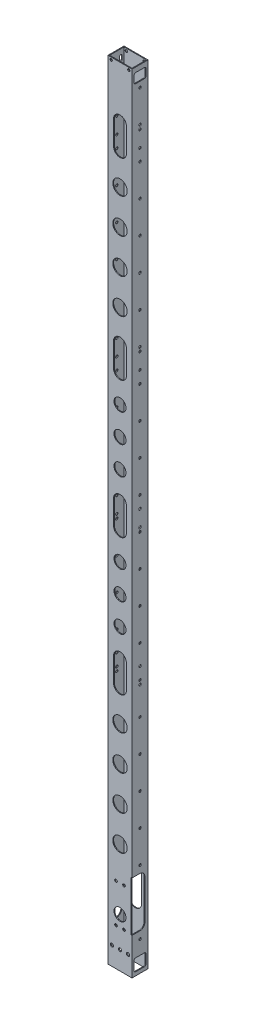
from build123d import *

# Parameters (mm, degrees)
SKETCH_1_W           = 30
SKETCH_1_H           = 20
SKETCH_1_W_2         = 28
SKETCH_1_H_2         = 18
EXTRUDE_1_DEPTH      = 980
SKETCH_3_R           = 1.5
CUT_EXTRUDE_2_DEPTH  = 981.51007134
CUT_EXTRUDE_3_DEPTH  = 981.51007134
SKETCH_5_W           = 15
SKETCH_5_H           = 12
CUT_EXTRUDE_4_DEPTH  = 10
SKETCH_6_R           = 9
SKETCH_6_R_2         = 7.5
CUT_EXTRUDE_5_DEPTH  = 981.318825689
SKETCH_9_R           = 1.5
CUT_EXTRUDE_7_DEPTH  = 981.318825689
SKETCH_13_W          = 30
SKETCH_13_H          = 20
SKETCH_13_W_2        = 28
SKETCH_13_H_2        = 18
EXTRUDE_2_DEPTH      = 10
CUT_EXTRUDE_8_DEPTH  = 60
SKETCH_15_W          = 15
SKETCH_15_H          = 15
CUT_EXTRUDE_10_DEPTH = 5
FILLET_1_R           = 2
SKETCH_16_R          = 2
CUT_EXTRUDE_11_DEPTH = 90
FILLET_2_R           = 2
SKETCH_17_R          = 1.5
CUT_EXTRUDE_12_DEPTH = 40
CUT_EXTRUDE_15_DEPTH = 51
SKETCH_21_W          = 22.187259215
SKETCH_21_H          = 65.33837704
EXTRUDE_3_DEPTH      = 1
SKETCH_22_R          = 1.65
CUT_EXTRUDE_16_DEPTH = 1
SKETCH_23_R          = 7.5
CUT_EXTRUDE_17_DEPTH = 10
SKETCH_24_W          = 30
SKETCH_24_H          = 20
CUT_EXTRUDE_18_DEPTH = 8
SKETCH_25_W          = 36.272891169
SKETCH_25_H          = 62
CUT_EXTRUDE_19_DEPTH = 1


with BuildPart() as part:
    # 草图1 → 凸台-拉伸1 (new body)
    with BuildSketch(Plane(origin=(0, 0, 0), x_dir=(1, 0, 0), z_dir=(0, 1, 0))):
        Rectangle(SKETCH_1_W, SKETCH_1_H)
        Rectangle(SKETCH_1_W_2, SKETCH_1_H_2, mode=Mode.SUBTRACT)
    extrude(amount=EXTRUDE_1_DEPTH)

    # 草图3 → 切除-拉伸2 (cut, through all)
    with BuildSketch(Plane(origin=(15, 0, 0), x_dir=(0, 0, -1), z_dir=(1, 0, 0))):
        with Locations((0, 890)):
            Circle(SKETCH_3_R)
        with Locations((0, 910)):
            Circle(SKETCH_3_R)
        with Locations((0, 500)):
            Circle(SKETCH_3_R)
        with Locations((0, 480)):
            Circle(SKETCH_3_R)
        with Locations((0, 670)):
            Circle(SKETCH_3_R)
        with Locations((0, 650)):
            Circle(SKETCH_3_R)
        with Locations((0, 330)):
            Circle(SKETCH_3_R)
        with Locations((0, 310)):
            Circle(SKETCH_3_R)
        with Locations((0, 70)):
            Circle(SKETCH_3_R)
        with Locations((0, 90)):
            Circle(SKETCH_3_R)
    extrude(amount=-CUT_EXTRUDE_2_DEPTH, mode=Mode.SUBTRACT)

    # 草图4 → 切除-拉伸3 (cut, through all)
    with BuildSketch(Plane(origin=(15, 0, 0), x_dir=(0, 0, -1), z_dir=(1, 0, 0))):
        with BuildLine():
            Line((3.4, 968), (3.4, 972))
            ThreePointArc((3.4, 972), (5, 973.6), (6.6, 972))
            Line((6.6, 972), (6.6, 968))
            ThreePointArc((6.6, 968), (5, 966.4), (3.4, 968))
        make_face()
        with BuildLine():
            Line((-3.4, 968), (-3.4, 972))
            ThreePointArc((-3.4, 972), (-5, 973.6), (-6.6, 972))
            Line((-6.6, 972), (-6.6, 968))
            ThreePointArc((-6.6, 968), (-5, 966.4), (-3.4, 968))
        make_face()
    extrude(amount=-CUT_EXTRUDE_3_DEPTH, mode=Mode.SUBTRACT)

    # 草图5 → 切除-拉伸4 (cut)
    with BuildSketch(Plane(origin=(15, 0, 0), x_dir=(0, 0, -1), z_dir=(1, 0, 0))):
        with Locations((0, 968)):
            Rectangle(SKETCH_5_W, SKETCH_5_H)
    extrude(amount=-CUT_EXTRUDE_4_DEPTH, mode=Mode.SUBTRACT)

    # 草图6 → 切除-拉伸5 (cut, through all)
    with BuildSketch(Plane(origin=(0, 0, -10), x_dir=(-1, 0, 0), z_dir=(0, 0, -1))):
        with Locations((0, 135)):
            Circle(SKETCH_6_R)
        with Locations((0, 178.333333333)):
            Circle(SKETCH_6_R)
        with Locations((0, 221.666666667)):
            Circle(SKETCH_6_R)
        with Locations((0, 265)):
            Circle(SKETCH_6_R)
        with Locations((0, 845)):
            Circle(SKETCH_6_R)
        with Locations((0, 801.666666667)):
            Circle(SKETCH_6_R)
        with Locations((0, 758.333333333)):
            Circle(SKETCH_6_R)
        with Locations((0, 715)):
            Circle(SKETCH_6_R)
        with Locations((0, 440)):
            Circle(SKETCH_6_R_2)
        with Locations((0, 405)):
            Circle(SKETCH_6_R_2)
        with Locations((0, 370)):
            Circle(SKETCH_6_R_2)
        with Locations((0, 610)):
            Circle(SKETCH_6_R_2)
        with Locations((0, 575)):
            Circle(SKETCH_6_R_2)
        with Locations((0, 540)):
            Circle(SKETCH_6_R_2)
        with BuildLine():
            Line((-8, 65), (-8, 95))
            ThreePointArc((-8, 95), (0, 103), (8, 95))
            Line((8, 95), (8, 65))
            ThreePointArc((8, 65), (0, 57), (-8, 65))
        make_face()
        with BuildLine():
            Line((-8, 305), (-8, 335))
            ThreePointArc((-8, 335), (0, 343), (8, 335))
            Line((8, 335), (8, 305))
            ThreePointArc((8, 305), (0, 297), (-8, 305))
        make_face()
        with BuildLine():
            Line((-8, 475), (-8, 505))
            ThreePointArc((-8, 505), (0, 513), (8, 505))
            Line((8, 505), (8, 475))
            ThreePointArc((8, 475), (0, 467), (-8, 475))
        make_face()
        with BuildLine():
            Line((-8, 645), (-8, 675))
            ThreePointArc((-8, 675), (0, 683), (8, 675))
            Line((8, 675), (8, 645))
            ThreePointArc((8, 645), (0, 637), (-8, 645))
        make_face()
        with BuildLine():
            Line((-8, 885), (-8, 915))
            ThreePointArc((-8, 915), (0, 923), (8, 915))
            Line((8, 915), (8, 885))
            ThreePointArc((8, 885), (0, 877), (-8, 885))
        make_face()
    extrude(amount=-CUT_EXTRUDE_5_DEPTH, mode=Mode.SUBTRACT)

    # 草图9 → 切除-拉伸7 (cut, through all)
    with BuildSketch(Plane.XY.offset(10)):
        with Locations((11, 977)):
            Circle(SKETCH_9_R)
        with Locations((-11, 977)):
            Circle(SKETCH_9_R)
    extrude(amount=-CUT_EXTRUDE_7_DEPTH, mode=Mode.SUBTRACT)

    # 草图13 → 凸台-拉伸2 (add)
    with BuildSketch(Plane.XZ):
        Rectangle(SKETCH_13_W, SKETCH_13_H)
        Rectangle(SKETCH_13_W_2, SKETCH_13_H_2, mode=Mode.SUBTRACT)
    extrude(amount=EXTRUDE_2_DEPTH)

    # 草图11 → 切除-拉伸8 (cut)
    with BuildSketch(Plane(origin=(-14, 0, 0), x_dir=(0, 0, -1), z_dir=(1, 0, 0))):
        with BuildLine():
            Line((-6.6, 5), (-6.6, 15))
            ThreePointArc((-6.6, 15), (-5, 16.6), (-3.4, 15))
            Line((-3.4, 15), (-3.4, 5))
            ThreePointArc((-3.4, 5), (-5, 3.4), (-6.6, 5))
        make_face()
        with BuildLine():
            Line((6.6, 5), (6.6, 15))
            ThreePointArc((6.6, 15), (5, 16.6), (3.4, 15))
            Line((3.4, 15), (3.4, 5))
            ThreePointArc((3.4, 5), (5, 3.4), (6.6, 5))
        make_face()
    extrude(amount=-CUT_EXTRUDE_8_DEPTH, mode=Mode.SUBTRACT)

    # 草图15 → 切除-拉伸10 (cut)
    with BuildSketch(Plane(origin=(15, 0, 0), x_dir=(0, 0, -1), z_dir=(1, 0, 0))):
        with Locations((0, 10)):
            Rectangle(SKETCH_15_W, SKETCH_15_H)
    extrude(amount=-CUT_EXTRUDE_10_DEPTH, mode=Mode.SUBTRACT)

    # 圆角1
    fillet_1_edges = [part.edges().sort_by_distance(p)[0] for p in [
        (14.5, 2.5, -7.5),
        (14.5, 2.5, 7.5),
        (14.5, 17.5, -7.5),
        (14.5, 17.5, 7.5),
    ]]
    fillet(fillet_1_edges, radius=FILLET_1_R)

    # 草图16 → 切除-拉伸11 (cut)
    with BuildSketch(Plane.XY.offset(10)):
        with Locations((10, 21)):
            Circle(SKETCH_16_R)
        with Locations((0, 21)):
            Circle(SKETCH_16_R)
        with Locations((-10, 21)):
            Circle(SKETCH_16_R)
    extrude(amount=-CUT_EXTRUDE_11_DEPTH, mode=Mode.SUBTRACT)

    # 圆角2
    fillet_2_edges = [part.edges().sort_by_distance(p)[0] for p in [
        (14.5, 962, -7.5),
        (14.5, 962, 7.5),
        (14.5, 974, 7.5),
        (14.5, 974, -7.5),
    ]]
    fillet(fillet_2_edges, radius=FILLET_2_R)

    # 草图17 → 切除-拉伸12 (cut)
    with BuildSketch(Plane(origin=(15, 0, 0), x_dir=(0, 0, -1), z_dir=(1, 0, 0))):
        with Locations((0, 955)):
            Circle(SKETCH_17_R)
        with Locations((0, 915)):
            Circle(SKETCH_17_R)
        with Locations((0, 875)):
            Circle(SKETCH_17_R)
        with Locations((0, 835)):
            Circle(SKETCH_17_R)
        with Locations((0, 795)):
            Circle(SKETCH_17_R)
        with Locations((0, 755)):
            Circle(SKETCH_17_R)
        with Locations((0, 715)):
            Circle(SKETCH_17_R)
        with Locations((0, 675)):
            Circle(SKETCH_17_R)
        with Locations((0, 635)):
            Circle(SKETCH_17_R)
        with Locations((0, 595)):
            Circle(SKETCH_17_R)
        with Locations((0, 555)):
            Circle(SKETCH_17_R)
        with Locations((0, 515)):
            Circle(SKETCH_17_R)
        with Locations((0, 475)):
            Circle(SKETCH_17_R)
        with Locations((0, 435)):
            Circle(SKETCH_17_R)
        with Locations((0, 395)):
            Circle(SKETCH_17_R)
        with Locations((0, 355)):
            Circle(SKETCH_17_R)
        with Locations((0, 315)):
            Circle(SKETCH_17_R)
        with Locations((0, 275)):
            Circle(SKETCH_17_R)
        with Locations((0, 235)):
            Circle(SKETCH_17_R)
        with Locations((0, 195)):
            Circle(SKETCH_17_R)
        with Locations((0, 155)):
            Circle(SKETCH_17_R)
        with Locations((0, 115)):
            Circle(SKETCH_17_R)
        with Locations((0, 75)):
            Circle(SKETCH_17_R)
        with Locations((0, 35)):
            Circle(SKETCH_17_R)
    extrude(amount=-CUT_EXTRUDE_12_DEPTH, mode=Mode.SUBTRACT)

    # 草图20 → 切除-拉伸15 (cut)
    with BuildSketch(Plane(origin=(15, 0, 0), x_dir=(0, 0, -1), z_dir=(1, 0, 0))):
        with BuildLine():
            Line((-6, 50), (-6, 100))
            ThreePointArc((-6, 100), (0, 106), (6, 100))
            Line((6, 100), (6, 50))
            ThreePointArc((6, 50), (0, 44), (-6, 50))
        make_face()
    extrude(amount=-CUT_EXTRUDE_15_DEPTH, mode=Mode.SUBTRACT)

    # 草图21 → 凸台-拉伸3 (add)
    with BuildSketch(Plane.XY.offset(10)):
        with Locations((-0.689634309, 76.201822832)):
            Rectangle(SKETCH_21_W, SKETCH_21_H)
    extrude(amount=-EXTRUDE_3_DEPTH)

    # 草图22 → 切除-拉伸16 (cut)
    with BuildSketch(Plane.XY.offset(10)):
        with Locations((5, 45)):
            Circle(SKETCH_22_R)
        with Locations((-5, 45)):
            Circle(SKETCH_22_R)
        with Locations((5, 93)):
            Circle(SKETCH_22_R)
        with Locations((-5, 93)):
            Circle(SKETCH_22_R)
    extrude(amount=-CUT_EXTRUDE_16_DEPTH, mode=Mode.SUBTRACT)

    # 草图23 → 切除-拉伸17 (cut)
    with BuildSketch(Plane.XY.offset(10)):
        with Locations((0, 59.25)):
            Circle(SKETCH_23_R)
    extrude(amount=-CUT_EXTRUDE_17_DEPTH, mode=Mode.SUBTRACT)

    # 草图24 → 切除-拉伸18 (cut)
    with BuildSketch(Plane.XZ.offset(10)):
        Rectangle(SKETCH_24_W, SKETCH_24_H)
    extrude(amount=-CUT_EXTRUDE_18_DEPTH, mode=Mode.SUBTRACT)

    # 草图25 → 切除-拉伸19 (cut)
    with BuildSketch(Plane(origin=(15, 0, 0), x_dir=(0, 0, -1), z_dir=(1, 0, 0))):
        with Locations((-18.136445585, 75)):
            Rectangle(SKETCH_25_W, SKETCH_25_H)
    extrude(amount=-CUT_EXTRUDE_19_DEPTH, mode=Mode.SUBTRACT)


solid = part.part
